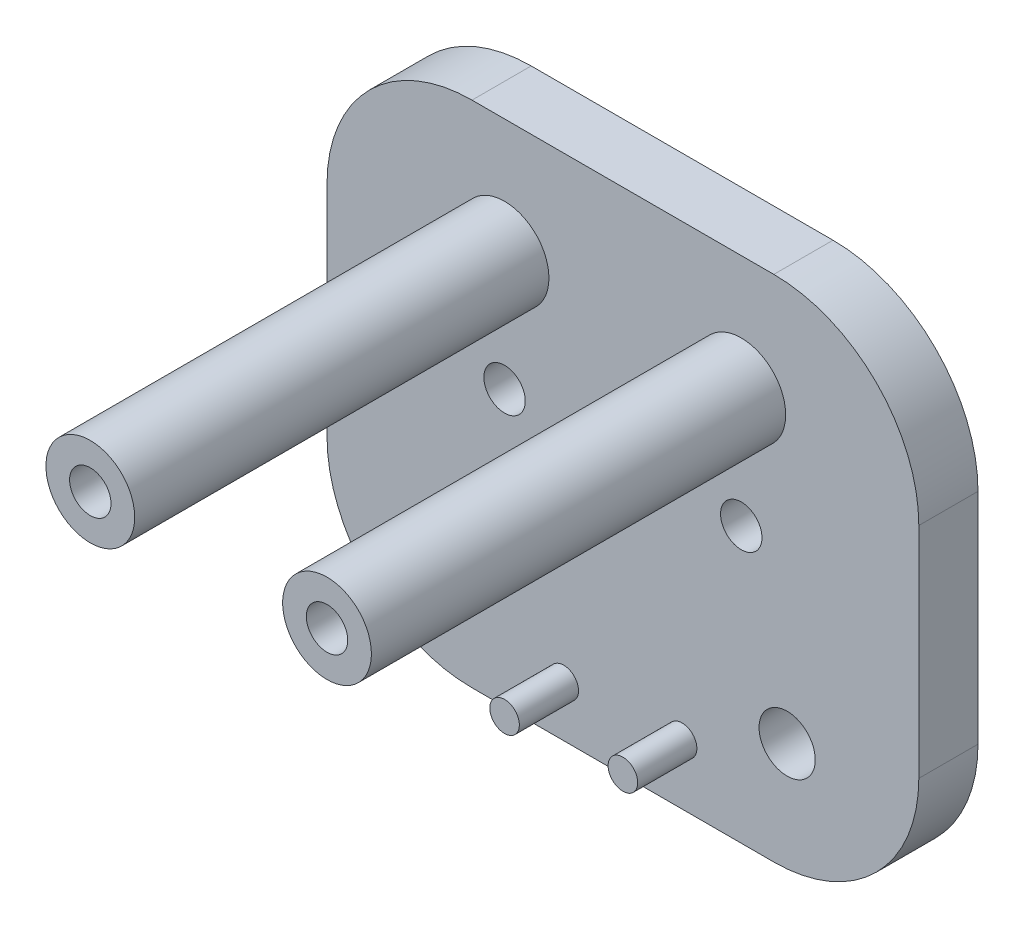
from build123d import *
from build123d.topology import SkipClean

# Parameters (mm, degrees)
BOSS_EXTRUDE1_DEPTH      = 6
BOSS_EXTRUDE1_DEPTH_BACK = 4
SKETCH1_W                = 100
SKETCH1_H                = 50
SKETCH2_R                = 4.75
CUT_EXTRUDE1_DEPTH       = 57.789083458
MOVE_FACE2_BY            = 15
SKETCH3_W                = 100
SKETCH3_H                = 12
BOSS_EXTRUDE2_DEPTH      = 70
SKETCH4_R                = 2.5
BOSS_EXTRUDE3_DEPTH      = 20
SKETCH5_W                = 100
SKETCH5_H                = 56.133601368
BOSS_EXTRUDE4_DEPTH      = 10
CUT_EXTRUDE2_START       = -10
SKETCH6_R                = 4.75
SKETCH6_R_2              = 2.5
CUT_EXTRUDE2_DEPTH       = 10
FILLET2_R                = 24.5
FILLET3_R                = 5
CUT_EXTRUDE3_START       = -10
CUT_EXTRUDE3_DEPTH       = 10
BOSS_EXTRUDE5_START      = -10
SKETCH8_R                = 2.5
BOSS_EXTRUDE5_DEPTH      = 10
MOVE_START               = -4
MOVE_FACE3_DEPTH         = 10
SKETCH11_R               = 7.5
BOSS_EXTRUDE6_DEPTH      = 70
CUT_EXTRUDE4_START       = -70
CUT_EXTRUDE4_DEPTH       = 70
SKETCH13_R               = 3.5
CUT_EXTRUDE5_DEPTH       = 103.46950766
MOVE_START_2             = 6
MOVE_FACE4_OUTLINE_R     = 7.5
MOVE_FACE4_OUTLINE_R_2   = 3.5
MOVE_FACE4_DEPTH         = 70
MOVE_FACE4_2_OUTLINE_R   = 7.5
MOVE_FACE4_2_OUTLINE_R_2 = 3.5
MOVE_FACE4_2_DEPTH       = 80
MOVE_FACE4_3_OUTLINE_R   = 3.5
MOVE_FACE4_3_DEPTH       = 10
MOVE_FACE5_DEPTH         = 10
MOVE_FACE5_2_DEPTH       = 10
MOVE_FACE6_DEPTH         = 10
SKETCH17_R               = 3.5
CUT_EXTRUDE9_DEPTH       = 10


# Read off the part's stored shape, not the designer's step: Move Face3, Move Face4, Move Face5, Move Face6
with BuildPart() as part:
    # Sketch1 → Boss-Extrude1 (new, two sides: drawn at the far end of the back side and taken through both)
    with BuildSketch(Plane.XY.offset(-BOSS_EXTRUDE1_DEPTH_BACK)):
        Rectangle(SKETCH1_W, SKETCH1_H)
    extrude(amount=BOSS_EXTRUDE1_DEPTH + BOSS_EXTRUDE1_DEPTH_BACK)

    # Sketch2 → Cut-Extrude1 (cut, through all)
    with BuildSketch(Plane.XY.offset(6)):
        with Locations((27.75, 0)):
            Circle(SKETCH2_R)
        with Locations((-27.75, 0)):
            Circle(SKETCH2_R)
    extrude(amount=-CUT_EXTRUDE1_DEPTH, mode=Mode.SUBTRACT)

    # Move Face2: a face moved outward by 15.0
    extrude(part.faces().sort_by_distance((0, 25, 1))[0], amount=MOVE_FACE2_BY, dir=(0, 1, 0))

    # Sketch3 → Boss-Extrude2 (add)
    with BuildSketch(Plane.XY.offset(6)):
        with Locations((0, 34)):
            Rectangle(SKETCH3_W, SKETCH3_H)
    extrude(amount=BOSS_EXTRUDE2_DEPTH)

    # Sketch4 → Boss-Extrude3 (add)
    with BuildSketch(Plane(origin=(0, 0, -4), x_dir=(-1, 0, 0), z_dir=(0, 0, -1))):
        with Locations((9.999238357, -11.441146597)):
            Circle(SKETCH4_R)
        with Locations((-10.000761643, -9.892069005)):
            Circle(SKETCH4_R)
    extrude(amount=-BOSS_EXTRUDE3_DEPTH)

    # Sketch5 → Boss-Extrude4 (add)
    with BuildSketch(Plane.XY.offset(76)):
        with Locations((0, 11.933199316)):
            Rectangle(SKETCH5_W, SKETCH5_H)
    extrude(amount=BOSS_EXTRUDE4_DEPTH)

    # Sketch6 → Cut-Extrude2 (cut)
    with BuildSketch(Plane(origin=(0, 0, -4), x_dir=(-1, 0, 0), z_dir=(0, 0, -1)).offset(CUT_EXTRUDE2_START)):
        with Locations(Location((27.75, 0, 0), (0, 0, 180))):
            Circle(SKETCH6_R)
        with Locations((10.004296788, -9.901140623)):
            Circle(SKETCH6_R_2)
        with Locations((-9.995700599, -9.91136318)):
            Circle(SKETCH6_R_2)
        with Locations(Location((-27.75, 0, 0), (0, 0, 180))):
            Circle(SKETCH6_R)
    extrude(amount=CUT_EXTRUDE2_DEPTH, mode=Mode.SUBTRACT)

    # Fillet2
    # the kernel refuses this fillet: 24.5 mm, written as the material it takes off along each edge
    with BuildSketch(Plane(origin=(50, -16.133601368, 14.75), x_dir=(0, 1, 0), z_dir=(0, 0, 1)), Plane(origin=(50, -25, -65.25), x_dir=(0, 1, 0), z_dir=(0, 0, 1))) as fillet2_piece_1:
        with BuildLine():
            CenterArc((FILLET2_R, FILLET2_R), FILLET2_R, 180, 90)
            Line((0, FILLET2_R), (0, 0))
            Line((0, 0), (FILLET2_R, 0))
        make_face()
    extrude(amount=132.5, mode=Mode.SUBTRACT)
    with BuildSketch(Plane(origin=(-50, 40, 147.25), x_dir=(0, -1, 0), z_dir=(0, 0, -1)), Plane(origin=(50, 40, -65.25), x_dir=(0, -1, 0), z_dir=(0, 0, 1))) as fillet2_piece_2:
        with BuildLine():
            CenterArc((FILLET2_R, -FILLET2_R), FILLET2_R, 90, 90)
            Line((0, -FILLET2_R), (0, 0))
            Line((0, 0), (FILLET2_R, 0))
        make_face()
    extrude(amount=212.5, mode=Mode.SUBTRACT)
    with BuildSketch(Plane(origin=(-50, -16.133601368, 14.75), x_dir=(0, 1, 0), z_dir=(0, 0, 1)), Plane(origin=(-50, -25, 67.25), x_dir=(1, 0, 0), z_dir=(0, 0, -1))) as fillet2_piece_3:
        with BuildLine():
            CenterArc((FILLET2_R, -FILLET2_R), FILLET2_R, 90, 90)
            Line((0, -FILLET2_R), (0, 0))
            Line((0, 0), (FILLET2_R, 0))
        make_face()
    extrude(amount=132.5, mode=Mode.SUBTRACT)

    # Fillet3
    fillet3_edges = [part.edges().sort_by_distance(p)[0] for p in [
        (46.571307506, 28, 41),
        (-46.571307506, 28, 41),
    ]]
    fillet(fillet3_edges, radius=FILLET3_R)

    # Sketch7 → Cut-Extrude3 (cut)
    with BuildSketch(Plane.XY.offset(86).offset(CUT_EXTRUDE3_START)):
        with BuildLine():
            Line((-25.5, -16.133601368), (25.5, -16.133601368))
            ThreePointArc((25.5, -16.133601368), (42.824116139, -8.957717507), (50, 8.366398632))
            Line((50, 8.366398632), (50, 15.5))
            ThreePointArc((50, 15.5), (42.824116139, 32.824116139), (25.5, 40))
            Line((25.5, 40), (-25.5, 40))
            ThreePointArc((-25.5, 40), (-42.824116139, 32.824116139), (-50, 15.5))
            Line((-50, 15.5), (-50, 8.366398632))
            ThreePointArc((-50, 8.366398632), (-42.824116139, -8.957717507), (-25.5, -16.133601368))
        make_face()
    extrude(amount=CUT_EXTRUDE3_DEPTH, mode=Mode.SUBTRACT)

    # Sketch8 → Boss-Extrude5 (add)
    with BuildSketch(Plane(origin=(0, 0, -4), x_dir=(-1, 0, 0), z_dir=(0, 0, -1)).offset(BOSS_EXTRUDE5_START)):
        with Locations((10.004296788, -9.901140623)):
            Circle(SKETCH8_R)
        with Locations((-9.995700599, -9.91136318)):
            Circle(SKETCH8_R)
    extrude(amount=BOSS_EXTRUDE5_DEPTH)

    # Move Face3 outline → Move Face3 (cut)
    with BuildSketch(Plane.XY.offset(MOVE_START)):
        with BuildLine():
            Line((25.5, -20), (-25.5, -20))
            ThreePointArc((-25.5, -20), (-42.824116139, -12.824116139), (-50, 4.5))
            Line((-50, 4.5), (-50, -0.5))
            ThreePointArc((-50, -0.5), (-42.824116139, -17.824116139), (-25.5, -25))
            Line((-25.5, -25), (25.5, -25))
            ThreePointArc((25.5, -25), (42.824116139, -17.824116139), (50, -0.5))
            Line((50, -0.5), (50, 4.5))
            ThreePointArc((50, 4.5), (42.824116139, -12.824116139), (25.5, -20))
        make_face()
    extrude(amount=MOVE_FACE3_DEPTH, mode=Mode.SUBTRACT)

    # Sketch11 → Boss-Extrude6 (add)
    with BuildSketch(Plane.XY.offset(6)):
        with Locations((-20, 28.450922409)):
            Circle(SKETCH11_R)
        with Locations((20, 28.450922409)):
            Circle(SKETCH11_R)
    extrude(amount=BOSS_EXTRUDE6_DEPTH)

    # Sketch12 → Cut-Extrude4 (cut)
    with SkipClean():  # the faces are left unmerged after this step: merging them gives an invalid solid
        with BuildSketch(Plane.XY.offset(76).offset(CUT_EXTRUDE4_START)):
            with BuildLine():
                Line((-34.102325267, 28), (-27.486432327, 28))
                ThreePointArc((-27.486432327, 28), (-20, 35.950922409), (-12.513567673, 28))
                Line((-12.513567673, 28), (12.513567673, 28))
                ThreePointArc((12.513567673, 28), (20, 35.950922409), (27.486432327, 28))
                Line((27.486432327, 28), (34.102325267, 28))
                ThreePointArc((34.102325267, 28), (38.972432937, 31.867722966), (36.308049694, 37.487179487))
                ThreePointArc((36.308049694, 37.487179487), (31.048157467, 39.363527583), (25.5, 40))
                Line((25.5, 40), (-25.5, 40))
                ThreePointArc((-25.5, 40), (-31.048157467, 39.363527583), (-36.308049694, 37.487179487))
                ThreePointArc((-36.308049694, 37.487179487), (-38.972432937, 31.867722966), (-34.102325267, 28))
            make_face()
        extrude(amount=CUT_EXTRUDE4_DEPTH, mode=Mode.SUBTRACT)

    # Sketch13 → Cut-Extrude5 (cut, through all)
    with SkipClean():  # the faces are left unmerged after this step: merging them gives an invalid solid
        with BuildSketch(Plane.XY.offset(76)):
            with Locations((-20, 28.450922409)):
                Circle(SKETCH13_R)
            with Locations((20, 28.450922409)):
                Circle(SKETCH13_R)
        extrude(amount=-CUT_EXTRUDE5_DEPTH, mode=Mode.SUBTRACT)

    # Move Face4 outline → Move Face4 (cut)
    # profile 1 of 2: a face of its own
    with BuildSketch(Plane.XY.offset(MOVE_START_2)):
        with Locations((20, 28.450922409)):
            Circle(MOVE_FACE4_OUTLINE_R)
        with Locations((20, 28.450922409)):
            Circle(MOVE_FACE4_OUTLINE_R_2, mode=Mode.SUBTRACT)
    # profile 2 of 2: a face of its own
    with BuildSketch(Plane.XY.offset(MOVE_START_2)):
        with Locations((-20, 28.450922409)):
            Circle(MOVE_FACE4_OUTLINE_R)
        with Locations((-20, 28.450922409)):
            Circle(MOVE_FACE4_OUTLINE_R_2, mode=Mode.SUBTRACT)
    extrude(amount=MOVE_FACE4_DEPTH, mode=Mode.SUBTRACT)

    # Move Face4 2 outline → Move Face4 2 (add)
    # profile 1 of 2: a face of its own
    with BuildSketch(Plane.XY.offset(MOVE_START)):
        with Locations((20, 46.450922409)):
            Circle(MOVE_FACE4_2_OUTLINE_R)
        with Locations((20, 46.450922409)):
            Circle(MOVE_FACE4_2_OUTLINE_R_2, mode=Mode.SUBTRACT)
    # profile 2 of 2: a face of its own
    with BuildSketch(Plane.XY.offset(MOVE_START)):
        with Locations((-20, 46.450922409)):
            Circle(MOVE_FACE4_2_OUTLINE_R)
        with Locations((-20, 46.450922409)):
            Circle(MOVE_FACE4_2_OUTLINE_R_2, mode=Mode.SUBTRACT)
    extrude(amount=MOVE_FACE4_2_DEPTH)

    # Move Face4 3 outline → Move Face4 3 (add)
    with BuildSketch(Plane.XY.offset(MOVE_START)):
        with BuildLine():
            ThreePointArc((50, 33.5), (42.824116139, 50.824116139), (25.5, 58))
            Line((25.5, 58), (-25.5, 58))
            ThreePointArc((-25.5, 58), (-42.824116139, 50.824116139), (-50, 33.5))
            Line((-50, 33.5), (-50, 15.5))
            ThreePointArc((-50, 15.5), (-42.824116139, 32.824116139), (-25.5, 40))
            Line((-25.5, 40), (-23.825650281, 40))
            ThreePointArc((-23.825650281, 40), (-20, 53.950922409), (-16.174349719, 40))
            Line((-16.174349719, 40), (16.174349719, 40))
            ThreePointArc((16.174349719, 40), (20, 53.950922409), (23.825650281, 40))
            Line((23.825650281, 40), (25.5, 40))
            ThreePointArc((25.5, 40), (42.824116139, 32.824116139), (50, 15.5))
            Line((50, 15.5), (50, 33.5))
        make_face()
        with Locations((20, 28.450922409)):
            Circle(MOVE_FACE4_3_OUTLINE_R)
        with Locations((-20, 28.450922409)):
            Circle(MOVE_FACE4_3_OUTLINE_R)
    extrude(amount=MOVE_FACE4_3_DEPTH)

    # Move Face5 outline → Move Face5 (cut)
    with BuildSketch(Plane.XY.offset(MOVE_START)):
        with BuildLine():
            ThreePointArc((-32.436349859, -0.775), (-27.75, -6.3), (-23.063650141, -0.775))
            ThreePointArc((-23.063650141, -0.775), (-27.75, -4.75), (-32.436349859, -0.775))
        make_face()
        with BuildLine():
            ThreePointArc((23.063650141, -0.775), (27.75, -6.3), (32.436349859, -0.775))
            ThreePointArc((32.436349859, -0.775), (27.75, -4.75), (23.063650141, -0.775))
        make_face()
    extrude(amount=MOVE_FACE5_DEPTH, mode=Mode.SUBTRACT)

    # Move Face5 2 outline → Move Face5 2 (add)
    with BuildSketch(Plane.XY.offset(MOVE_START)):
        with BuildLine():
            ThreePointArc((-32.436349859, -0.775), (-27.75, 3.2), (-23.063650141, -0.775))
            ThreePointArc((-23.063650141, -0.775), (-27.75, 4.75), (-32.436349859, -0.775))
        make_face()
        with BuildLine():
            ThreePointArc((23.063650141, -0.775), (27.75, 3.2), (32.436349859, -0.775))
            ThreePointArc((32.436349859, -0.775), (27.75, 4.75), (23.063650141, -0.775))
        make_face()
    extrude(amount=MOVE_FACE5_2_DEPTH)

    # Move Face6 outline → Move Face6 (add)
    with BuildSketch(Plane.XY.offset(MOVE_START)):
        with BuildLine():
            ThreePointArc((50, 41.5), (42.824116139, 58.824116139), (25.5, 66))
            Line((25.5, 66), (-25.5, 66))
            ThreePointArc((-25.5, 66), (-42.824116139, 58.824116139), (-50, 41.5))
            Line((-50, 41.5), (-50, 33.5))
            ThreePointArc((-50, 33.5), (-42.824116139, 50.824116139), (-25.5, 58))
            Line((-25.5, 58), (25.5, 58))
            ThreePointArc((25.5, 58), (42.824116139, 50.824116139), (50, 33.5))
            Line((50, 33.5), (50, 41.5))
        make_face()
    extrude(amount=MOVE_FACE6_DEPTH)

    # Sketch17 → Cut-Extrude9 (cut)
    with BuildSketch(Plane(origin=(0, 0, -4), x_dir=(-1, 0, 0), z_dir=(0, 0, -1))):
        with Locations((-20, 26.450922409)):
            Circle(SKETCH17_R)
        with Locations((20, 26.450922409)):
            Circle(SKETCH17_R)
    extrude(amount=-CUT_EXTRUDE9_DEPTH, mode=Mode.SUBTRACT)


solid = part.part
